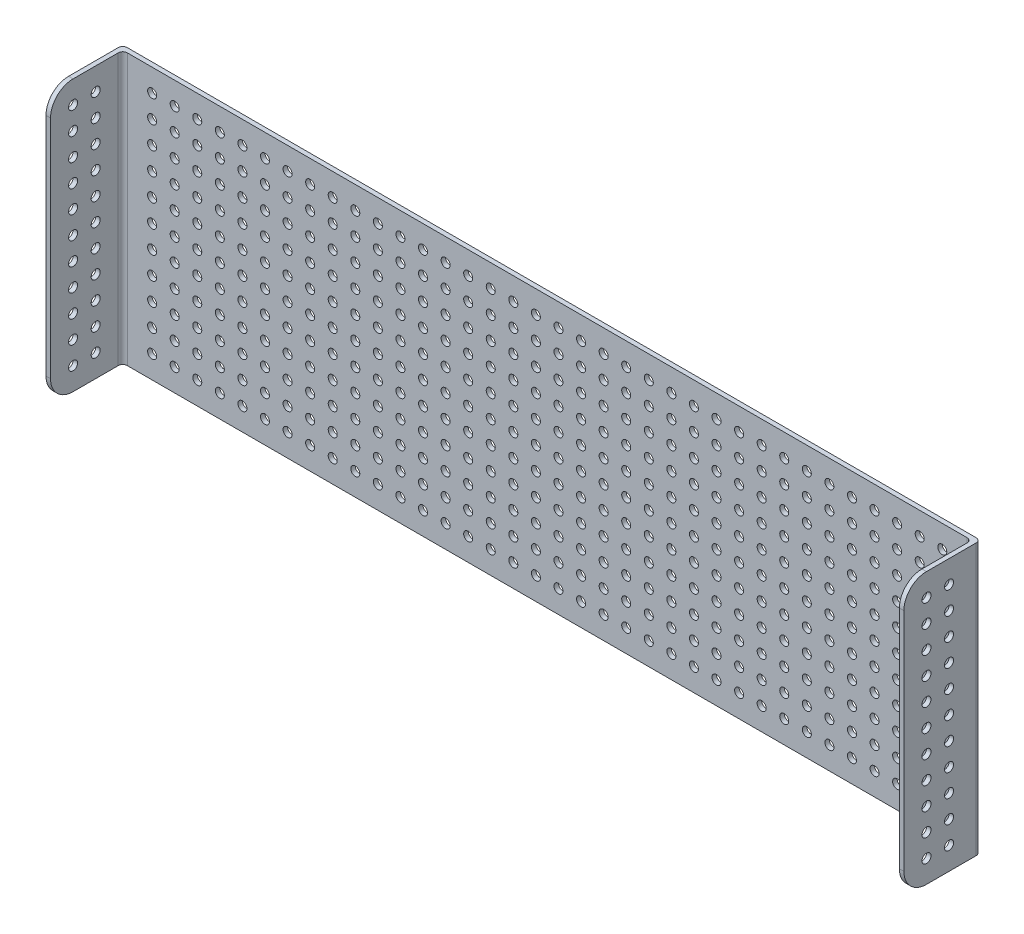
from build123d import *

# Parameters (mm, degrees)
IZIM1_W             = 380
IZIM1_H             = 120
IZIM1_R             = 2
BOSS_EXTRUDE1_DEPTH = 2
IZIM3_W             = 2
IZIM3_H             = 120
TOP_HOLES_DEPTH     = 32
IZIM4_R             = 2
CUT_EXTRUDE1_DEPTH  = 393.770402665
FILLET1_R           = 2
FILLET2_R           = 10


with BuildPart() as part:
    # Çizim1 → Boss-Extrude1 (new body)
    with BuildSketch(Plane.XY):
        with Locations((124.668181205, -33.341251384)):
            Rectangle(IZIM1_W, IZIM1_H)
        with Locations((299.668181205, 16.658748616)):
            Circle(IZIM1_R, mode=Mode.SUBTRACT)
        with Locations((289.668181205, 16.658748616)):
            Circle(IZIM1_R, mode=Mode.SUBTRACT)
        with Locations((279.668181205, 16.658748616)):
            Circle(IZIM1_R, mode=Mode.SUBTRACT)
        with Locations((269.668181205, 16.658748616)):
            Circle(IZIM1_R, mode=Mode.SUBTRACT)
        with Locations((259.668181205, 16.658748616)):
            Circle(IZIM1_R, mode=Mode.SUBTRACT)
        with Locations((249.668181205, 16.658748616)):
            Circle(IZIM1_R, mode=Mode.SUBTRACT)
        with Locations((239.668181205, 16.658748616)):
            Circle(IZIM1_R, mode=Mode.SUBTRACT)
        with Locations((229.668181205, 16.658748616)):
            Circle(IZIM1_R, mode=Mode.SUBTRACT)
        with Locations((219.668181205, 16.658748616)):
            Circle(IZIM1_R, mode=Mode.SUBTRACT)
        with Locations((209.668181205, 16.658748616)):
            Circle(IZIM1_R, mode=Mode.SUBTRACT)
        with Locations((199.668181205, 16.658748616)):
            Circle(IZIM1_R, mode=Mode.SUBTRACT)
        with Locations((189.668181205, 16.658748616)):
            Circle(IZIM1_R, mode=Mode.SUBTRACT)
        with Locations((179.668181205, 16.658748616)):
            Circle(IZIM1_R, mode=Mode.SUBTRACT)
        with Locations((169.668181205, 16.658748616)):
            Circle(IZIM1_R, mode=Mode.SUBTRACT)
        with Locations((159.668181205, 16.658748616)):
            Circle(IZIM1_R, mode=Mode.SUBTRACT)
        with Locations((149.668181205, 16.658748616)):
            Circle(IZIM1_R, mode=Mode.SUBTRACT)
        with Locations((139.668181205, 16.658748616)):
            Circle(IZIM1_R, mode=Mode.SUBTRACT)
        with Locations((129.668181205, 16.658748616)):
            Circle(IZIM1_R, mode=Mode.SUBTRACT)
        with Locations((119.668181205, 16.658748616)):
            Circle(IZIM1_R, mode=Mode.SUBTRACT)
        with Locations((109.668181205, 16.658748616)):
            Circle(IZIM1_R, mode=Mode.SUBTRACT)
        with Locations((99.668181205, 16.658748616)):
            Circle(IZIM1_R, mode=Mode.SUBTRACT)
        with Locations((89.668181205, 16.658748616)):
            Circle(IZIM1_R, mode=Mode.SUBTRACT)
        with Locations((79.668181205, 16.658748616)):
            Circle(IZIM1_R, mode=Mode.SUBTRACT)
        with Locations((69.668181205, 16.658748616)):
            Circle(IZIM1_R, mode=Mode.SUBTRACT)
        with Locations((59.668181205, 16.658748616)):
            Circle(IZIM1_R, mode=Mode.SUBTRACT)
        with Locations((49.668181205, 16.658748616)):
            Circle(IZIM1_R, mode=Mode.SUBTRACT)
        with Locations((39.668181205, 16.658748616)):
            Circle(IZIM1_R, mode=Mode.SUBTRACT)
        with Locations((29.668181205, 16.658748616)):
            Circle(IZIM1_R, mode=Mode.SUBTRACT)
        with Locations((19.668181205, 16.658748616)):
            Circle(IZIM1_R, mode=Mode.SUBTRACT)
        with Locations((9.668181205, 16.658748616)):
            Circle(IZIM1_R, mode=Mode.SUBTRACT)
        with Locations((-0.331818795, 16.658748616)):
            Circle(IZIM1_R, mode=Mode.SUBTRACT)
        with Locations((-10.331818795, 16.658748616)):
            Circle(IZIM1_R, mode=Mode.SUBTRACT)
        with Locations((-20.331818795, 16.658748616)):
            Circle(IZIM1_R, mode=Mode.SUBTRACT)
        with Locations((-30.331818795, 16.658748616)):
            Circle(IZIM1_R, mode=Mode.SUBTRACT)
        with Locations((-40.331818795, 16.658748616)):
            Circle(IZIM1_R, mode=Mode.SUBTRACT)
        with Locations((-50.331818795, 16.658748616)):
            Circle(IZIM1_R, mode=Mode.SUBTRACT)
        with Locations((289.668181205, 6.658748616)):
            Circle(IZIM1_R, mode=Mode.SUBTRACT)
        with Locations((279.668181205, 6.658748616)):
            Circle(IZIM1_R, mode=Mode.SUBTRACT)
        with Locations((269.668181205, 6.658748616)):
            Circle(IZIM1_R, mode=Mode.SUBTRACT)
        with Locations((259.668181205, 6.658748616)):
            Circle(IZIM1_R, mode=Mode.SUBTRACT)
        with Locations((249.668181205, 6.658748616)):
            Circle(IZIM1_R, mode=Mode.SUBTRACT)
        with Locations((239.668181205, 6.658748616)):
            Circle(IZIM1_R, mode=Mode.SUBTRACT)
        with Locations((229.668181205, 6.658748616)):
            Circle(IZIM1_R, mode=Mode.SUBTRACT)
        with Locations((219.668181205, 6.658748616)):
            Circle(IZIM1_R, mode=Mode.SUBTRACT)
        with Locations((209.668181205, 6.658748616)):
            Circle(IZIM1_R, mode=Mode.SUBTRACT)
        with Locations((199.668181205, 6.658748616)):
            Circle(IZIM1_R, mode=Mode.SUBTRACT)
        with Locations((189.668181205, 6.658748616)):
            Circle(IZIM1_R, mode=Mode.SUBTRACT)
        with Locations((179.668181205, 6.658748616)):
            Circle(IZIM1_R, mode=Mode.SUBTRACT)
        with Locations((169.668181205, 6.658748616)):
            Circle(IZIM1_R, mode=Mode.SUBTRACT)
        with Locations((159.668181205, 6.658748616)):
            Circle(IZIM1_R, mode=Mode.SUBTRACT)
        with Locations((149.668181205, 6.658748616)):
            Circle(IZIM1_R, mode=Mode.SUBTRACT)
        with Locations((139.668181205, 6.658748616)):
            Circle(IZIM1_R, mode=Mode.SUBTRACT)
        with Locations((129.668181205, 6.658748616)):
            Circle(IZIM1_R, mode=Mode.SUBTRACT)
        with Locations((119.668181205, 6.658748616)):
            Circle(IZIM1_R, mode=Mode.SUBTRACT)
        with Locations((109.668181205, 6.658748616)):
            Circle(IZIM1_R, mode=Mode.SUBTRACT)
        with Locations((99.668181205, 6.658748616)):
            Circle(IZIM1_R, mode=Mode.SUBTRACT)
        with Locations((89.668181205, 6.658748616)):
            Circle(IZIM1_R, mode=Mode.SUBTRACT)
        with Locations((79.668181205, 6.658748616)):
            Circle(IZIM1_R, mode=Mode.SUBTRACT)
        with Locations((69.668181205, 6.658748616)):
            Circle(IZIM1_R, mode=Mode.SUBTRACT)
        with Locations((59.668181205, 6.658748616)):
            Circle(IZIM1_R, mode=Mode.SUBTRACT)
        with Locations((49.668181205, 6.658748616)):
            Circle(IZIM1_R, mode=Mode.SUBTRACT)
        with Locations((39.668181205, 6.658748616)):
            Circle(IZIM1_R, mode=Mode.SUBTRACT)
        with Locations((29.668181205, 6.658748616)):
            Circle(IZIM1_R, mode=Mode.SUBTRACT)
        with Locations((19.668181205, 6.658748616)):
            Circle(IZIM1_R, mode=Mode.SUBTRACT)
        with Locations((9.668181205, 6.658748616)):
            Circle(IZIM1_R, mode=Mode.SUBTRACT)
        with Locations((-0.331818795, 6.658748616)):
            Circle(IZIM1_R, mode=Mode.SUBTRACT)
        with Locations((-10.331818795, 6.658748616)):
            Circle(IZIM1_R, mode=Mode.SUBTRACT)
        with Locations((-20.331818795, 6.658748616)):
            Circle(IZIM1_R, mode=Mode.SUBTRACT)
        with Locations((-30.331818795, 6.658748616)):
            Circle(IZIM1_R, mode=Mode.SUBTRACT)
        with Locations((-40.331818795, 6.658748616)):
            Circle(IZIM1_R, mode=Mode.SUBTRACT)
        with Locations((-50.331818795, 6.658748616)):
            Circle(IZIM1_R, mode=Mode.SUBTRACT)
        with Locations((289.668181205, -3.341251384)):
            Circle(IZIM1_R, mode=Mode.SUBTRACT)
        with Locations((279.668181205, -3.341251384)):
            Circle(IZIM1_R, mode=Mode.SUBTRACT)
        with Locations((269.668181205, -3.341251384)):
            Circle(IZIM1_R, mode=Mode.SUBTRACT)
        with Locations((259.668181205, -3.341251384)):
            Circle(IZIM1_R, mode=Mode.SUBTRACT)
        with Locations((249.668181205, -3.341251384)):
            Circle(IZIM1_R, mode=Mode.SUBTRACT)
        with Locations((239.668181205, -3.341251384)):
            Circle(IZIM1_R, mode=Mode.SUBTRACT)
        with Locations((229.668181205, -3.341251384)):
            Circle(IZIM1_R, mode=Mode.SUBTRACT)
        with Locations((219.668181205, -3.341251384)):
            Circle(IZIM1_R, mode=Mode.SUBTRACT)
        with Locations((209.668181205, -3.341251384)):
            Circle(IZIM1_R, mode=Mode.SUBTRACT)
        with Locations((199.668181205, -3.341251384)):
            Circle(IZIM1_R, mode=Mode.SUBTRACT)
        with Locations((189.668181205, -3.341251384)):
            Circle(IZIM1_R, mode=Mode.SUBTRACT)
        with Locations((179.668181205, -3.341251384)):
            Circle(IZIM1_R, mode=Mode.SUBTRACT)
        with Locations((169.668181205, -3.341251384)):
            Circle(IZIM1_R, mode=Mode.SUBTRACT)
        with Locations((159.668181205, -3.341251384)):
            Circle(IZIM1_R, mode=Mode.SUBTRACT)
        with Locations((149.668181205, -3.341251384)):
            Circle(IZIM1_R, mode=Mode.SUBTRACT)
        with Locations((139.668181205, -3.341251384)):
            Circle(IZIM1_R, mode=Mode.SUBTRACT)
        with Locations((129.668181205, -3.341251384)):
            Circle(IZIM1_R, mode=Mode.SUBTRACT)
        with Locations((119.668181205, -3.341251384)):
            Circle(IZIM1_R, mode=Mode.SUBTRACT)
        with Locations((109.668181205, -3.341251384)):
            Circle(IZIM1_R, mode=Mode.SUBTRACT)
        with Locations((99.668181205, -3.341251384)):
            Circle(IZIM1_R, mode=Mode.SUBTRACT)
        with Locations((89.668181205, -3.341251384)):
            Circle(IZIM1_R, mode=Mode.SUBTRACT)
        with Locations((79.668181205, -3.341251384)):
            Circle(IZIM1_R, mode=Mode.SUBTRACT)
        with Locations((69.668181205, -3.341251384)):
            Circle(IZIM1_R, mode=Mode.SUBTRACT)
        with Locations((59.668181205, -3.341251384)):
            Circle(IZIM1_R, mode=Mode.SUBTRACT)
        with Locations((49.668181205, -3.341251384)):
            Circle(IZIM1_R, mode=Mode.SUBTRACT)
        with Locations((39.668181205, -3.341251384)):
            Circle(IZIM1_R, mode=Mode.SUBTRACT)
        with Locations((29.668181205, -3.341251384)):
            Circle(IZIM1_R, mode=Mode.SUBTRACT)
        with Locations((19.668181205, -3.341251384)):
            Circle(IZIM1_R, mode=Mode.SUBTRACT)
        with Locations((9.668181205, -3.341251384)):
            Circle(IZIM1_R, mode=Mode.SUBTRACT)
        with Locations((-0.331818795, -3.341251384)):
            Circle(IZIM1_R, mode=Mode.SUBTRACT)
        with Locations((-10.331818795, -3.341251384)):
            Circle(IZIM1_R, mode=Mode.SUBTRACT)
        with Locations((-20.331818795, -3.341251384)):
            Circle(IZIM1_R, mode=Mode.SUBTRACT)
        with Locations((-30.331818795, -3.341251384)):
            Circle(IZIM1_R, mode=Mode.SUBTRACT)
        with Locations((-40.331818795, -3.341251384)):
            Circle(IZIM1_R, mode=Mode.SUBTRACT)
        with Locations((-50.331818795, -3.341251384)):
            Circle(IZIM1_R, mode=Mode.SUBTRACT)
        with Locations((289.668181205, -13.341251384)):
            Circle(IZIM1_R, mode=Mode.SUBTRACT)
        with Locations((279.668181205, -13.341251384)):
            Circle(IZIM1_R, mode=Mode.SUBTRACT)
        with Locations((269.668181205, -13.341251384)):
            Circle(IZIM1_R, mode=Mode.SUBTRACT)
        with Locations((259.668181205, -13.341251384)):
            Circle(IZIM1_R, mode=Mode.SUBTRACT)
        with Locations((249.668181205, -13.341251384)):
            Circle(IZIM1_R, mode=Mode.SUBTRACT)
        with Locations((239.668181205, -13.341251384)):
            Circle(IZIM1_R, mode=Mode.SUBTRACT)
        with Locations((229.668181205, -13.341251384)):
            Circle(IZIM1_R, mode=Mode.SUBTRACT)
        with Locations((219.668181205, -13.341251384)):
            Circle(IZIM1_R, mode=Mode.SUBTRACT)
        with Locations((209.668181205, -13.341251384)):
            Circle(IZIM1_R, mode=Mode.SUBTRACT)
        with Locations((199.668181205, -13.341251384)):
            Circle(IZIM1_R, mode=Mode.SUBTRACT)
        with Locations((189.668181205, -13.341251384)):
            Circle(IZIM1_R, mode=Mode.SUBTRACT)
        with Locations((179.668181205, -13.341251384)):
            Circle(IZIM1_R, mode=Mode.SUBTRACT)
        with Locations((169.668181205, -13.341251384)):
            Circle(IZIM1_R, mode=Mode.SUBTRACT)
        with Locations((159.668181205, -13.341251384)):
            Circle(IZIM1_R, mode=Mode.SUBTRACT)
        with Locations((149.668181205, -13.341251384)):
            Circle(IZIM1_R, mode=Mode.SUBTRACT)
        with Locations((139.668181205, -13.341251384)):
            Circle(IZIM1_R, mode=Mode.SUBTRACT)
        with Locations((129.668181205, -13.341251384)):
            Circle(IZIM1_R, mode=Mode.SUBTRACT)
        with Locations((119.668181205, -13.341251384)):
            Circle(IZIM1_R, mode=Mode.SUBTRACT)
        with Locations((109.668181205, -13.341251384)):
            Circle(IZIM1_R, mode=Mode.SUBTRACT)
        with Locations((99.668181205, -13.341251384)):
            Circle(IZIM1_R, mode=Mode.SUBTRACT)
        with Locations((89.668181205, -13.341251384)):
            Circle(IZIM1_R, mode=Mode.SUBTRACT)
        with Locations((79.668181205, -13.341251384)):
            Circle(IZIM1_R, mode=Mode.SUBTRACT)
        with Locations((69.668181205, -13.341251384)):
            Circle(IZIM1_R, mode=Mode.SUBTRACT)
        with Locations((59.668181205, -13.341251384)):
            Circle(IZIM1_R, mode=Mode.SUBTRACT)
        with Locations((49.668181205, -13.341251384)):
            Circle(IZIM1_R, mode=Mode.SUBTRACT)
        with Locations((39.668181205, -13.341251384)):
            Circle(IZIM1_R, mode=Mode.SUBTRACT)
        with Locations((29.668181205, -13.341251384)):
            Circle(IZIM1_R, mode=Mode.SUBTRACT)
        with Locations((19.668181205, -13.341251384)):
            Circle(IZIM1_R, mode=Mode.SUBTRACT)
        with Locations((9.668181205, -13.341251384)):
            Circle(IZIM1_R, mode=Mode.SUBTRACT)
        with Locations((-0.331818795, -13.341251384)):
            Circle(IZIM1_R, mode=Mode.SUBTRACT)
        with Locations((-10.331818795, -13.341251384)):
            Circle(IZIM1_R, mode=Mode.SUBTRACT)
        with Locations((-20.331818795, -13.341251384)):
            Circle(IZIM1_R, mode=Mode.SUBTRACT)
        with Locations((-30.331818795, -13.341251384)):
            Circle(IZIM1_R, mode=Mode.SUBTRACT)
        with Locations((-40.331818795, -13.341251384)):
            Circle(IZIM1_R, mode=Mode.SUBTRACT)
        with Locations((-50.331818795, -13.341251384)):
            Circle(IZIM1_R, mode=Mode.SUBTRACT)
        with Locations((289.668181205, -23.341251384)):
            Circle(IZIM1_R, mode=Mode.SUBTRACT)
        with Locations((279.668181205, -23.341251384)):
            Circle(IZIM1_R, mode=Mode.SUBTRACT)
        with Locations((269.668181205, -23.341251384)):
            Circle(IZIM1_R, mode=Mode.SUBTRACT)
        with Locations((259.668181205, -23.341251384)):
            Circle(IZIM1_R, mode=Mode.SUBTRACT)
        with Locations((249.668181205, -23.341251384)):
            Circle(IZIM1_R, mode=Mode.SUBTRACT)
        with Locations((239.668181205, -23.341251384)):
            Circle(IZIM1_R, mode=Mode.SUBTRACT)
        with Locations((229.668181205, -23.341251384)):
            Circle(IZIM1_R, mode=Mode.SUBTRACT)
        with Locations((219.668181205, -23.341251384)):
            Circle(IZIM1_R, mode=Mode.SUBTRACT)
        with Locations((209.668181205, -23.341251384)):
            Circle(IZIM1_R, mode=Mode.SUBTRACT)
        with Locations((199.668181205, -23.341251384)):
            Circle(IZIM1_R, mode=Mode.SUBTRACT)
        with Locations((189.668181205, -23.341251384)):
            Circle(IZIM1_R, mode=Mode.SUBTRACT)
        with Locations((179.668181205, -23.341251384)):
            Circle(IZIM1_R, mode=Mode.SUBTRACT)
        with Locations((169.668181205, -23.341251384)):
            Circle(IZIM1_R, mode=Mode.SUBTRACT)
        with Locations((159.668181205, -23.341251384)):
            Circle(IZIM1_R, mode=Mode.SUBTRACT)
        with Locations((149.668181205, -23.341251384)):
            Circle(IZIM1_R, mode=Mode.SUBTRACT)
        with Locations((139.668181205, -23.341251384)):
            Circle(IZIM1_R, mode=Mode.SUBTRACT)
        with Locations((129.668181205, -23.341251384)):
            Circle(IZIM1_R, mode=Mode.SUBTRACT)
        with Locations((119.668181205, -23.341251384)):
            Circle(IZIM1_R, mode=Mode.SUBTRACT)
        with Locations((109.668181205, -23.341251384)):
            Circle(IZIM1_R, mode=Mode.SUBTRACT)
        with Locations((99.668181205, -23.341251384)):
            Circle(IZIM1_R, mode=Mode.SUBTRACT)
        with Locations((89.668181205, -23.341251384)):
            Circle(IZIM1_R, mode=Mode.SUBTRACT)
        with Locations((79.668181205, -23.341251384)):
            Circle(IZIM1_R, mode=Mode.SUBTRACT)
        with Locations((69.668181205, -23.341251384)):
            Circle(IZIM1_R, mode=Mode.SUBTRACT)
        with Locations((59.668181205, -23.341251384)):
            Circle(IZIM1_R, mode=Mode.SUBTRACT)
        with Locations((49.668181205, -23.341251384)):
            Circle(IZIM1_R, mode=Mode.SUBTRACT)
        with Locations((39.668181205, -23.341251384)):
            Circle(IZIM1_R, mode=Mode.SUBTRACT)
        with Locations((29.668181205, -23.341251384)):
            Circle(IZIM1_R, mode=Mode.SUBTRACT)
        with Locations((19.668181205, -23.341251384)):
            Circle(IZIM1_R, mode=Mode.SUBTRACT)
        with Locations((9.668181205, -23.341251384)):
            Circle(IZIM1_R, mode=Mode.SUBTRACT)
        with Locations((-0.331818795, -23.341251384)):
            Circle(IZIM1_R, mode=Mode.SUBTRACT)
        with Locations((-10.331818795, -23.341251384)):
            Circle(IZIM1_R, mode=Mode.SUBTRACT)
        with Locations((-20.331818795, -23.341251384)):
            Circle(IZIM1_R, mode=Mode.SUBTRACT)
        with Locations((-30.331818795, -23.341251384)):
            Circle(IZIM1_R, mode=Mode.SUBTRACT)
        with Locations((-40.331818795, -23.341251384)):
            Circle(IZIM1_R, mode=Mode.SUBTRACT)
        with Locations((-50.331818795, -23.341251384)):
            Circle(IZIM1_R, mode=Mode.SUBTRACT)
        with Locations((289.668181205, -33.341251384)):
            Circle(IZIM1_R, mode=Mode.SUBTRACT)
        with Locations((279.668181205, -33.341251384)):
            Circle(IZIM1_R, mode=Mode.SUBTRACT)
        with Locations((269.668181205, -33.341251384)):
            Circle(IZIM1_R, mode=Mode.SUBTRACT)
        with Locations((259.668181205, -33.341251384)):
            Circle(IZIM1_R, mode=Mode.SUBTRACT)
        with Locations((249.668181205, -33.341251384)):
            Circle(IZIM1_R, mode=Mode.SUBTRACT)
        with Locations((239.668181205, -33.341251384)):
            Circle(IZIM1_R, mode=Mode.SUBTRACT)
        with Locations((229.668181205, -33.341251384)):
            Circle(IZIM1_R, mode=Mode.SUBTRACT)
        with Locations((219.668181205, -33.341251384)):
            Circle(IZIM1_R, mode=Mode.SUBTRACT)
        with Locations((209.668181205, -33.341251384)):
            Circle(IZIM1_R, mode=Mode.SUBTRACT)
        with Locations((199.668181205, -33.341251384)):
            Circle(IZIM1_R, mode=Mode.SUBTRACT)
        with Locations((189.668181205, -33.341251384)):
            Circle(IZIM1_R, mode=Mode.SUBTRACT)
        with Locations((179.668181205, -33.341251384)):
            Circle(IZIM1_R, mode=Mode.SUBTRACT)
        with Locations((169.668181205, -33.341251384)):
            Circle(IZIM1_R, mode=Mode.SUBTRACT)
        with Locations((159.668181205, -33.341251384)):
            Circle(IZIM1_R, mode=Mode.SUBTRACT)
        with Locations((149.668181205, -33.341251384)):
            Circle(IZIM1_R, mode=Mode.SUBTRACT)
        with Locations((139.668181205, -33.341251384)):
            Circle(IZIM1_R, mode=Mode.SUBTRACT)
        with Locations((129.668181205, -33.341251384)):
            Circle(IZIM1_R, mode=Mode.SUBTRACT)
        with Locations((119.668181205, -33.341251384)):
            Circle(IZIM1_R, mode=Mode.SUBTRACT)
        with Locations((109.668181205, -33.341251384)):
            Circle(IZIM1_R, mode=Mode.SUBTRACT)
        with Locations((99.668181205, -33.341251384)):
            Circle(IZIM1_R, mode=Mode.SUBTRACT)
        with Locations((89.668181205, -33.341251384)):
            Circle(IZIM1_R, mode=Mode.SUBTRACT)
        with Locations((79.668181205, -33.341251384)):
            Circle(IZIM1_R, mode=Mode.SUBTRACT)
        with Locations((69.668181205, -33.341251384)):
            Circle(IZIM1_R, mode=Mode.SUBTRACT)
        with Locations((59.668181205, -33.341251384)):
            Circle(IZIM1_R, mode=Mode.SUBTRACT)
        with Locations((49.668181205, -33.341251384)):
            Circle(IZIM1_R, mode=Mode.SUBTRACT)
        with Locations((39.668181205, -33.341251384)):
            Circle(IZIM1_R, mode=Mode.SUBTRACT)
        with Locations((29.668181205, -33.341251384)):
            Circle(IZIM1_R, mode=Mode.SUBTRACT)
        with Locations((19.668181205, -33.341251384)):
            Circle(IZIM1_R, mode=Mode.SUBTRACT)
        with Locations((9.668181205, -33.341251384)):
            Circle(IZIM1_R, mode=Mode.SUBTRACT)
        with Locations((-0.331818795, -33.341251384)):
            Circle(IZIM1_R, mode=Mode.SUBTRACT)
        with Locations((-10.331818795, -33.341251384)):
            Circle(IZIM1_R, mode=Mode.SUBTRACT)
        with Locations((-20.331818795, -33.341251384)):
            Circle(IZIM1_R, mode=Mode.SUBTRACT)
        with Locations((-30.331818795, -33.341251384)):
            Circle(IZIM1_R, mode=Mode.SUBTRACT)
        with Locations((-40.331818795, -33.341251384)):
            Circle(IZIM1_R, mode=Mode.SUBTRACT)
        with Locations((-50.331818795, -33.341251384)):
            Circle(IZIM1_R, mode=Mode.SUBTRACT)
        with Locations((289.668181205, -43.341251384)):
            Circle(IZIM1_R, mode=Mode.SUBTRACT)
        with Locations((279.668181205, -43.341251384)):
            Circle(IZIM1_R, mode=Mode.SUBTRACT)
        with Locations((269.668181205, -43.341251384)):
            Circle(IZIM1_R, mode=Mode.SUBTRACT)
        with Locations((259.668181205, -43.341251384)):
            Circle(IZIM1_R, mode=Mode.SUBTRACT)
        with Locations((249.668181205, -43.341251384)):
            Circle(IZIM1_R, mode=Mode.SUBTRACT)
        with Locations((239.668181205, -43.341251384)):
            Circle(IZIM1_R, mode=Mode.SUBTRACT)
        with Locations((229.668181205, -43.341251384)):
            Circle(IZIM1_R, mode=Mode.SUBTRACT)
        with Locations((219.668181205, -43.341251384)):
            Circle(IZIM1_R, mode=Mode.SUBTRACT)
        with Locations((209.668181205, -43.341251384)):
            Circle(IZIM1_R, mode=Mode.SUBTRACT)
        with Locations((199.668181205, -43.341251384)):
            Circle(IZIM1_R, mode=Mode.SUBTRACT)
        with Locations((189.668181205, -43.341251384)):
            Circle(IZIM1_R, mode=Mode.SUBTRACT)
        with Locations((179.668181205, -43.341251384)):
            Circle(IZIM1_R, mode=Mode.SUBTRACT)
        with Locations((169.668181205, -43.341251384)):
            Circle(IZIM1_R, mode=Mode.SUBTRACT)
        with Locations((159.668181205, -43.341251384)):
            Circle(IZIM1_R, mode=Mode.SUBTRACT)
        with Locations((149.668181205, -43.341251384)):
            Circle(IZIM1_R, mode=Mode.SUBTRACT)
        with Locations((139.668181205, -43.341251384)):
            Circle(IZIM1_R, mode=Mode.SUBTRACT)
        with Locations((129.668181205, -43.341251384)):
            Circle(IZIM1_R, mode=Mode.SUBTRACT)
        with Locations((119.668181205, -43.341251384)):
            Circle(IZIM1_R, mode=Mode.SUBTRACT)
        with Locations((109.668181205, -43.341251384)):
            Circle(IZIM1_R, mode=Mode.SUBTRACT)
        with Locations((99.668181205, -43.341251384)):
            Circle(IZIM1_R, mode=Mode.SUBTRACT)
        with Locations((89.668181205, -43.341251384)):
            Circle(IZIM1_R, mode=Mode.SUBTRACT)
        with Locations((79.668181205, -43.341251384)):
            Circle(IZIM1_R, mode=Mode.SUBTRACT)
        with Locations((69.668181205, -43.341251384)):
            Circle(IZIM1_R, mode=Mode.SUBTRACT)
        with Locations((59.668181205, -43.341251384)):
            Circle(IZIM1_R, mode=Mode.SUBTRACT)
        with Locations((49.668181205, -43.341251384)):
            Circle(IZIM1_R, mode=Mode.SUBTRACT)
        with Locations((39.668181205, -43.341251384)):
            Circle(IZIM1_R, mode=Mode.SUBTRACT)
        with Locations((29.668181205, -43.341251384)):
            Circle(IZIM1_R, mode=Mode.SUBTRACT)
        with Locations((19.668181205, -43.341251384)):
            Circle(IZIM1_R, mode=Mode.SUBTRACT)
        with Locations((9.668181205, -43.341251384)):
            Circle(IZIM1_R, mode=Mode.SUBTRACT)
        with Locations((-0.331818795, -43.341251384)):
            Circle(IZIM1_R, mode=Mode.SUBTRACT)
        with Locations((-10.331818795, -43.341251384)):
            Circle(IZIM1_R, mode=Mode.SUBTRACT)
        with Locations((-20.331818795, -43.341251384)):
            Circle(IZIM1_R, mode=Mode.SUBTRACT)
        with Locations((-30.331818795, -43.341251384)):
            Circle(IZIM1_R, mode=Mode.SUBTRACT)
        with Locations((-40.331818795, -43.341251384)):
            Circle(IZIM1_R, mode=Mode.SUBTRACT)
        with Locations((-50.331818795, -43.341251384)):
            Circle(IZIM1_R, mode=Mode.SUBTRACT)
        with Locations((289.668181205, -53.341251384)):
            Circle(IZIM1_R, mode=Mode.SUBTRACT)
        with Locations((279.668181205, -53.341251384)):
            Circle(IZIM1_R, mode=Mode.SUBTRACT)
        with Locations((269.668181205, -53.341251384)):
            Circle(IZIM1_R, mode=Mode.SUBTRACT)
        with Locations((259.668181205, -53.341251384)):
            Circle(IZIM1_R, mode=Mode.SUBTRACT)
        with Locations((249.668181205, -53.341251384)):
            Circle(IZIM1_R, mode=Mode.SUBTRACT)
        with Locations((239.668181205, -53.341251384)):
            Circle(IZIM1_R, mode=Mode.SUBTRACT)
        with Locations((229.668181205, -53.341251384)):
            Circle(IZIM1_R, mode=Mode.SUBTRACT)
        with Locations((219.668181205, -53.341251384)):
            Circle(IZIM1_R, mode=Mode.SUBTRACT)
        with Locations((209.668181205, -53.341251384)):
            Circle(IZIM1_R, mode=Mode.SUBTRACT)
        with Locations((199.668181205, -53.341251384)):
            Circle(IZIM1_R, mode=Mode.SUBTRACT)
        with Locations((189.668181205, -53.341251384)):
            Circle(IZIM1_R, mode=Mode.SUBTRACT)
        with Locations((179.668181205, -53.341251384)):
            Circle(IZIM1_R, mode=Mode.SUBTRACT)
        with Locations((169.668181205, -53.341251384)):
            Circle(IZIM1_R, mode=Mode.SUBTRACT)
        with Locations((159.668181205, -53.341251384)):
            Circle(IZIM1_R, mode=Mode.SUBTRACT)
        with Locations((149.668181205, -53.341251384)):
            Circle(IZIM1_R, mode=Mode.SUBTRACT)
        with Locations((139.668181205, -53.341251384)):
            Circle(IZIM1_R, mode=Mode.SUBTRACT)
        with Locations((129.668181205, -53.341251384)):
            Circle(IZIM1_R, mode=Mode.SUBTRACT)
        with Locations((119.668181205, -53.341251384)):
            Circle(IZIM1_R, mode=Mode.SUBTRACT)
        with Locations((109.668181205, -53.341251384)):
            Circle(IZIM1_R, mode=Mode.SUBTRACT)
        with Locations((99.668181205, -53.341251384)):
            Circle(IZIM1_R, mode=Mode.SUBTRACT)
        with Locations((89.668181205, -53.341251384)):
            Circle(IZIM1_R, mode=Mode.SUBTRACT)
        with Locations((79.668181205, -53.341251384)):
            Circle(IZIM1_R, mode=Mode.SUBTRACT)
        with Locations((69.668181205, -53.341251384)):
            Circle(IZIM1_R, mode=Mode.SUBTRACT)
        with Locations((59.668181205, -53.341251384)):
            Circle(IZIM1_R, mode=Mode.SUBTRACT)
        with Locations((49.668181205, -53.341251384)):
            Circle(IZIM1_R, mode=Mode.SUBTRACT)
        with Locations((39.668181205, -53.341251384)):
            Circle(IZIM1_R, mode=Mode.SUBTRACT)
        with Locations((29.668181205, -53.341251384)):
            Circle(IZIM1_R, mode=Mode.SUBTRACT)
        with Locations((19.668181205, -53.341251384)):
            Circle(IZIM1_R, mode=Mode.SUBTRACT)
        with Locations((9.668181205, -53.341251384)):
            Circle(IZIM1_R, mode=Mode.SUBTRACT)
        with Locations((-0.331818795, -53.341251384)):
            Circle(IZIM1_R, mode=Mode.SUBTRACT)
        with Locations((-10.331818795, -53.341251384)):
            Circle(IZIM1_R, mode=Mode.SUBTRACT)
        with Locations((-20.331818795, -53.341251384)):
            Circle(IZIM1_R, mode=Mode.SUBTRACT)
        with Locations((-30.331818795, -53.341251384)):
            Circle(IZIM1_R, mode=Mode.SUBTRACT)
        with Locations((-40.331818795, -53.341251384)):
            Circle(IZIM1_R, mode=Mode.SUBTRACT)
        with Locations((-50.331818795, -53.341251384)):
            Circle(IZIM1_R, mode=Mode.SUBTRACT)
        with Locations((289.668181205, -63.341251384)):
            Circle(IZIM1_R, mode=Mode.SUBTRACT)
        with Locations((279.668181205, -63.341251384)):
            Circle(IZIM1_R, mode=Mode.SUBTRACT)
        with Locations((269.668181205, -63.341251384)):
            Circle(IZIM1_R, mode=Mode.SUBTRACT)
        with Locations((259.668181205, -63.341251384)):
            Circle(IZIM1_R, mode=Mode.SUBTRACT)
        with Locations((249.668181205, -63.341251384)):
            Circle(IZIM1_R, mode=Mode.SUBTRACT)
        with Locations((239.668181205, -63.341251384)):
            Circle(IZIM1_R, mode=Mode.SUBTRACT)
        with Locations((229.668181205, -63.341251384)):
            Circle(IZIM1_R, mode=Mode.SUBTRACT)
        with Locations((219.668181205, -63.341251384)):
            Circle(IZIM1_R, mode=Mode.SUBTRACT)
        with Locations((209.668181205, -63.341251384)):
            Circle(IZIM1_R, mode=Mode.SUBTRACT)
        with Locations((199.668181205, -63.341251384)):
            Circle(IZIM1_R, mode=Mode.SUBTRACT)
        with Locations((189.668181205, -63.341251384)):
            Circle(IZIM1_R, mode=Mode.SUBTRACT)
        with Locations((179.668181205, -63.341251384)):
            Circle(IZIM1_R, mode=Mode.SUBTRACT)
        with Locations((169.668181205, -63.341251384)):
            Circle(IZIM1_R, mode=Mode.SUBTRACT)
        with Locations((159.668181205, -63.341251384)):
            Circle(IZIM1_R, mode=Mode.SUBTRACT)
        with Locations((149.668181205, -63.341251384)):
            Circle(IZIM1_R, mode=Mode.SUBTRACT)
        with Locations((139.668181205, -63.341251384)):
            Circle(IZIM1_R, mode=Mode.SUBTRACT)
        with Locations((129.668181205, -63.341251384)):
            Circle(IZIM1_R, mode=Mode.SUBTRACT)
        with Locations((119.668181205, -63.341251384)):
            Circle(IZIM1_R, mode=Mode.SUBTRACT)
        with Locations((109.668181205, -63.341251384)):
            Circle(IZIM1_R, mode=Mode.SUBTRACT)
        with Locations((99.668181205, -63.341251384)):
            Circle(IZIM1_R, mode=Mode.SUBTRACT)
        with Locations((89.668181205, -63.341251384)):
            Circle(IZIM1_R, mode=Mode.SUBTRACT)
        with Locations((79.668181205, -63.341251384)):
            Circle(IZIM1_R, mode=Mode.SUBTRACT)
        with Locations((69.668181205, -63.341251384)):
            Circle(IZIM1_R, mode=Mode.SUBTRACT)
        with Locations((59.668181205, -63.341251384)):
            Circle(IZIM1_R, mode=Mode.SUBTRACT)
        with Locations((49.668181205, -63.341251384)):
            Circle(IZIM1_R, mode=Mode.SUBTRACT)
        with Locations((39.668181205, -63.341251384)):
            Circle(IZIM1_R, mode=Mode.SUBTRACT)
        with Locations((29.668181205, -63.341251384)):
            Circle(IZIM1_R, mode=Mode.SUBTRACT)
        with Locations((19.668181205, -63.341251384)):
            Circle(IZIM1_R, mode=Mode.SUBTRACT)
        with Locations((9.668181205, -63.341251384)):
            Circle(IZIM1_R, mode=Mode.SUBTRACT)
        with Locations((-0.331818795, -63.341251384)):
            Circle(IZIM1_R, mode=Mode.SUBTRACT)
        with Locations((-10.331818795, -63.341251384)):
            Circle(IZIM1_R, mode=Mode.SUBTRACT)
        with Locations((-20.331818795, -63.341251384)):
            Circle(IZIM1_R, mode=Mode.SUBTRACT)
        with Locations((-30.331818795, -63.341251384)):
            Circle(IZIM1_R, mode=Mode.SUBTRACT)
        with Locations((-40.331818795, -63.341251384)):
            Circle(IZIM1_R, mode=Mode.SUBTRACT)
        with Locations((-50.331818795, -63.341251384)):
            Circle(IZIM1_R, mode=Mode.SUBTRACT)
        with Locations((289.668181205, -73.341251384)):
            Circle(IZIM1_R, mode=Mode.SUBTRACT)
        with Locations((279.668181205, -73.341251384)):
            Circle(IZIM1_R, mode=Mode.SUBTRACT)
        with Locations((269.668181205, -73.341251384)):
            Circle(IZIM1_R, mode=Mode.SUBTRACT)
        with Locations((259.668181205, -73.341251384)):
            Circle(IZIM1_R, mode=Mode.SUBTRACT)
        with Locations((249.668181205, -73.341251384)):
            Circle(IZIM1_R, mode=Mode.SUBTRACT)
        with Locations((239.668181205, -73.341251384)):
            Circle(IZIM1_R, mode=Mode.SUBTRACT)
        with Locations((229.668181205, -73.341251384)):
            Circle(IZIM1_R, mode=Mode.SUBTRACT)
        with Locations((219.668181205, -73.341251384)):
            Circle(IZIM1_R, mode=Mode.SUBTRACT)
        with Locations((209.668181205, -73.341251384)):
            Circle(IZIM1_R, mode=Mode.SUBTRACT)
        with Locations((199.668181205, -73.341251384)):
            Circle(IZIM1_R, mode=Mode.SUBTRACT)
        with Locations((189.668181205, -73.341251384)):
            Circle(IZIM1_R, mode=Mode.SUBTRACT)
        with Locations((179.668181205, -73.341251384)):
            Circle(IZIM1_R, mode=Mode.SUBTRACT)
        with Locations((169.668181205, -73.341251384)):
            Circle(IZIM1_R, mode=Mode.SUBTRACT)
        with Locations((159.668181205, -73.341251384)):
            Circle(IZIM1_R, mode=Mode.SUBTRACT)
        with Locations((149.668181205, -73.341251384)):
            Circle(IZIM1_R, mode=Mode.SUBTRACT)
        with Locations((139.668181205, -73.341251384)):
            Circle(IZIM1_R, mode=Mode.SUBTRACT)
        with Locations((129.668181205, -73.341251384)):
            Circle(IZIM1_R, mode=Mode.SUBTRACT)
        with Locations((119.668181205, -73.341251384)):
            Circle(IZIM1_R, mode=Mode.SUBTRACT)
        with Locations((109.668181205, -73.341251384)):
            Circle(IZIM1_R, mode=Mode.SUBTRACT)
        with Locations((99.668181205, -73.341251384)):
            Circle(IZIM1_R, mode=Mode.SUBTRACT)
        with Locations((89.668181205, -73.341251384)):
            Circle(IZIM1_R, mode=Mode.SUBTRACT)
        with Locations((79.668181205, -73.341251384)):
            Circle(IZIM1_R, mode=Mode.SUBTRACT)
        with Locations((69.668181205, -73.341251384)):
            Circle(IZIM1_R, mode=Mode.SUBTRACT)
        with Locations((59.668181205, -73.341251384)):
            Circle(IZIM1_R, mode=Mode.SUBTRACT)
        with Locations((49.668181205, -73.341251384)):
            Circle(IZIM1_R, mode=Mode.SUBTRACT)
        with Locations((39.668181205, -73.341251384)):
            Circle(IZIM1_R, mode=Mode.SUBTRACT)
        with Locations((29.668181205, -73.341251384)):
            Circle(IZIM1_R, mode=Mode.SUBTRACT)
        with Locations((19.668181205, -73.341251384)):
            Circle(IZIM1_R, mode=Mode.SUBTRACT)
        with Locations((9.668181205, -73.341251384)):
            Circle(IZIM1_R, mode=Mode.SUBTRACT)
        with Locations((-0.331818795, -73.341251384)):
            Circle(IZIM1_R, mode=Mode.SUBTRACT)
        with Locations((-10.331818795, -73.341251384)):
            Circle(IZIM1_R, mode=Mode.SUBTRACT)
        with Locations((-20.331818795, -73.341251384)):
            Circle(IZIM1_R, mode=Mode.SUBTRACT)
        with Locations((-30.331818795, -73.341251384)):
            Circle(IZIM1_R, mode=Mode.SUBTRACT)
        with Locations((-40.331818795, -73.341251384)):
            Circle(IZIM1_R, mode=Mode.SUBTRACT)
        with Locations((-50.331818795, -73.341251384)):
            Circle(IZIM1_R, mode=Mode.SUBTRACT)
        with Locations((289.668181205, -83.341251384)):
            Circle(IZIM1_R, mode=Mode.SUBTRACT)
        with Locations((279.668181205, -83.341251384)):
            Circle(IZIM1_R, mode=Mode.SUBTRACT)
        with Locations((269.668181205, -83.341251384)):
            Circle(IZIM1_R, mode=Mode.SUBTRACT)
        with Locations((259.668181205, -83.341251384)):
            Circle(IZIM1_R, mode=Mode.SUBTRACT)
        with Locations((249.668181205, -83.341251384)):
            Circle(IZIM1_R, mode=Mode.SUBTRACT)
        with Locations((239.668181205, -83.341251384)):
            Circle(IZIM1_R, mode=Mode.SUBTRACT)
        with Locations((229.668181205, -83.341251384)):
            Circle(IZIM1_R, mode=Mode.SUBTRACT)
        with Locations((219.668181205, -83.341251384)):
            Circle(IZIM1_R, mode=Mode.SUBTRACT)
        with Locations((209.668181205, -83.341251384)):
            Circle(IZIM1_R, mode=Mode.SUBTRACT)
        with Locations((199.668181205, -83.341251384)):
            Circle(IZIM1_R, mode=Mode.SUBTRACT)
        with Locations((189.668181205, -83.341251384)):
            Circle(IZIM1_R, mode=Mode.SUBTRACT)
        with Locations((179.668181205, -83.341251384)):
            Circle(IZIM1_R, mode=Mode.SUBTRACT)
        with Locations((169.668181205, -83.341251384)):
            Circle(IZIM1_R, mode=Mode.SUBTRACT)
        with Locations((159.668181205, -83.341251384)):
            Circle(IZIM1_R, mode=Mode.SUBTRACT)
        with Locations((149.668181205, -83.341251384)):
            Circle(IZIM1_R, mode=Mode.SUBTRACT)
        with Locations((139.668181205, -83.341251384)):
            Circle(IZIM1_R, mode=Mode.SUBTRACT)
        with Locations((129.668181205, -83.341251384)):
            Circle(IZIM1_R, mode=Mode.SUBTRACT)
        with Locations((119.668181205, -83.341251384)):
            Circle(IZIM1_R, mode=Mode.SUBTRACT)
        with Locations((109.668181205, -83.341251384)):
            Circle(IZIM1_R, mode=Mode.SUBTRACT)
        with Locations((99.668181205, -83.341251384)):
            Circle(IZIM1_R, mode=Mode.SUBTRACT)
        with Locations((89.668181205, -83.341251384)):
            Circle(IZIM1_R, mode=Mode.SUBTRACT)
        with Locations((79.668181205, -83.341251384)):
            Circle(IZIM1_R, mode=Mode.SUBTRACT)
        with Locations((69.668181205, -83.341251384)):
            Circle(IZIM1_R, mode=Mode.SUBTRACT)
        with Locations((59.668181205, -83.341251384)):
            Circle(IZIM1_R, mode=Mode.SUBTRACT)
        with Locations((49.668181205, -83.341251384)):
            Circle(IZIM1_R, mode=Mode.SUBTRACT)
        with Locations((39.668181205, -83.341251384)):
            Circle(IZIM1_R, mode=Mode.SUBTRACT)
        with Locations((29.668181205, -83.341251384)):
            Circle(IZIM1_R, mode=Mode.SUBTRACT)
        with Locations((19.668181205, -83.341251384)):
            Circle(IZIM1_R, mode=Mode.SUBTRACT)
        with Locations((9.668181205, -83.341251384)):
            Circle(IZIM1_R, mode=Mode.SUBTRACT)
        with Locations((-0.331818795, -83.341251384)):
            Circle(IZIM1_R, mode=Mode.SUBTRACT)
        with Locations((-10.331818795, -83.341251384)):
            Circle(IZIM1_R, mode=Mode.SUBTRACT)
        with Locations((-20.331818795, -83.341251384)):
            Circle(IZIM1_R, mode=Mode.SUBTRACT)
        with Locations((-30.331818795, -83.341251384)):
            Circle(IZIM1_R, mode=Mode.SUBTRACT)
        with Locations((-40.331818795, -83.341251384)):
            Circle(IZIM1_R, mode=Mode.SUBTRACT)
        with Locations((-50.331818795, -83.341251384)):
            Circle(IZIM1_R, mode=Mode.SUBTRACT)
        with Locations((299.668181205, 6.658748616)):
            Circle(IZIM1_R, mode=Mode.SUBTRACT)
        with Locations((299.668181205, -3.341251384)):
            Circle(IZIM1_R, mode=Mode.SUBTRACT)
        with Locations((299.668181205, -13.341251384)):
            Circle(IZIM1_R, mode=Mode.SUBTRACT)
        with Locations((299.668181205, -23.341251384)):
            Circle(IZIM1_R, mode=Mode.SUBTRACT)
        with Locations((299.668181205, -33.341251384)):
            Circle(IZIM1_R, mode=Mode.SUBTRACT)
        with Locations((299.668181205, -43.341251384)):
            Circle(IZIM1_R, mode=Mode.SUBTRACT)
        with Locations((299.668181205, -53.341251384)):
            Circle(IZIM1_R, mode=Mode.SUBTRACT)
        with Locations((299.668181205, -63.341251384)):
            Circle(IZIM1_R, mode=Mode.SUBTRACT)
        with Locations((299.668181205, -73.341251384)):
            Circle(IZIM1_R, mode=Mode.SUBTRACT)
        with Locations((299.668181205, -83.341251384)):
            Circle(IZIM1_R, mode=Mode.SUBTRACT)
    extrude(amount=BOSS_EXTRUDE1_DEPTH)

    # Çizim3 → Top Holes (add)
    with BuildSketch(Plane.XY.offset(2)):
        with Locations((-64.331818795, -33.341251384)):
            Rectangle(IZIM3_W, IZIM3_H)
        with Locations((313.668181205, -33.341251384)):
            Rectangle(IZIM3_W, IZIM3_H)
    extrude(amount=TOP_HOLES_DEPTH)

    # Çizim4 → Cut-Extrude1 (cut, through all)
    with BuildSketch(Plane.ZY.offset(65.331818795)):
        with Locations(Location((14, -83.341251384, 0), (0, 0, 270))):
            Circle(IZIM4_R)
        with Locations(Location((24, -83.341251384, 0), (0, 0, 270))):
            Circle(IZIM4_R)
        with Locations(Location((24, -73.341251384, 0), (0, 0, 270))):
            Circle(IZIM4_R)
        with Locations(Location((24, -63.341251384, 0), (0, 0, 270))):
            Circle(IZIM4_R)
        with Locations(Location((24, -53.341251384, 0), (0, 0, 270))):
            Circle(IZIM4_R)
        with Locations(Location((24, -43.341251384, 0), (0, 0, 270))):
            Circle(IZIM4_R)
        with Locations(Location((24, -33.341251384, 0), (0, 0, 270))):
            Circle(IZIM4_R)
        with Locations(Location((24, -23.341251384, 0), (0, 0, 270))):
            Circle(IZIM4_R)
        with Locations(Location((24, -13.341251384, 0), (0, 0, 270))):
            Circle(IZIM4_R)
        with Locations(Location((24, -3.341251384, 0), (0, 0, 270))):
            Circle(IZIM4_R)
        with Locations(Location((24, 6.658748616, 0), (0, 0, 270))):
            Circle(IZIM4_R)
        with Locations(Location((24, 16.658748616, 0), (0, 0, 270))):
            Circle(IZIM4_R)
        with Locations(Location((14, -73.341251384, 0), (0, 0, 270))):
            Circle(IZIM4_R)
        with Locations(Location((14, -63.341251384, 0), (0, 0, 270))):
            Circle(IZIM4_R)
        with Locations(Location((14, -53.341251384, 0), (0, 0, 270))):
            Circle(IZIM4_R)
        with Locations(Location((14, -43.341251384, 0), (0, 0, 270))):
            Circle(IZIM4_R)
        with Locations(Location((14, -33.341251384, 0), (0, 0, 270))):
            Circle(IZIM4_R)
        with Locations(Location((14, -23.341251384, 0), (0, 0, 270))):
            Circle(IZIM4_R)
        with Locations(Location((14, -13.341251384, 0), (0, 0, 270))):
            Circle(IZIM4_R)
        with Locations(Location((14, -3.341251384, 0), (0, 0, 270))):
            Circle(IZIM4_R)
        with Locations(Location((14, 6.658748616, 0), (0, 0, 270))):
            Circle(IZIM4_R)
        with Locations(Location((14, 16.658748616, 0), (0, 0, 270))):
            Circle(IZIM4_R)
    extrude(amount=-CUT_EXTRUDE1_DEPTH, mode=Mode.SUBTRACT)

    # Fillet1
    fillet1_edges = [part.edges().sort_by_distance(p)[0] for p in [
        (-63.331818795, -33.341251384, 2),
        (312.668181205, -33.341251384, 2),
        (314.668181205, -33.341251384, 0),
        (-65.331818795, -33.341251384, 0),
    ]]
    fillet(fillet1_edges, radius=FILLET1_R)

    # Fillet2
    fillet2_edges = [part.edges().sort_by_distance(p)[0] for p in [
        (-64.331818795, -93.341251384, 34),
        (-64.331818795, 26.658748616, 34),
        (313.668181205, -93.341251384, 34),
        (313.668181205, 26.658748616, 34),
    ]]
    fillet(fillet2_edges, radius=FILLET2_R)


solid = part.part
